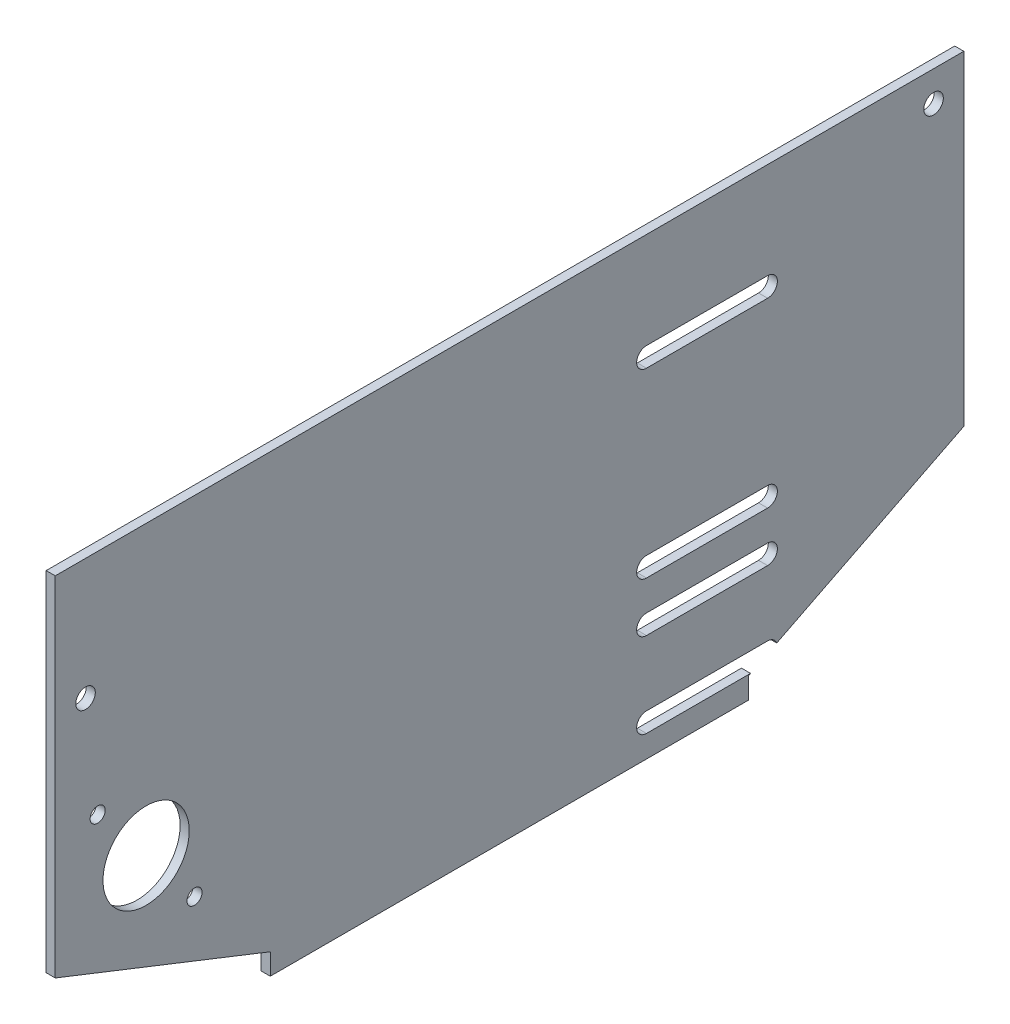
from build123d import *

# Parameters (mm, degrees)
SKETCH1_W           = 300
SKETCH1_H           = 150
SKETCH1_R           = 14.235
BOSS_EXTRUDE1_DEPTH = 3
CUT_EXTRUDE1_REACH  = 337.424
SKETCH2_R           = 3.225
SKETCH3_R           = 2.4892
CUT_EXTRUDE2_DEPTH  = 336.423612765
CUT_EXTRUDE3_DEPTH  = 336.423612765
CUT_EXTRUDE4_DEPTH  = 10


with BuildPart() as part:
    # Sketch1 → Boss-Extrude1 (new body)
    with BuildSketch(Plane(origin=(0, 0, 0), x_dir=(0, 0, -1), z_dir=(1, 0, 0))):
        with Locations((150, 75)):
            Rectangle(SKETCH1_W, SKETCH1_H)
        with Locations((30, 55)):
            Circle(SKETCH1_R, mode=Mode.SUBTRACT)
    extrude(amount=BOSS_EXTRUDE1_DEPTH)

    # Sketch2 → Cut-Extrude1 (cut, up to next)
    with BuildSketch(Plane.ZY, mode=Mode.PRIVATE) as cut_extrude1_sk1:
        with Locations((-290, 140)):
            Circle(SKETCH2_R)
    cut_extrude1_tool1 = extrude(cut_extrude1_sk1.sketch, amount=-CUT_EXTRUDE1_REACH, mode=Mode.PRIVATE) & part.part
    # Sketch2 → Cut-Extrude1 (cut, up to next)
    with BuildSketch(Plane.ZY, mode=Mode.PRIVATE) as cut_extrude1_sk2:
        with Locations((-10, 110)):
            Circle(SKETCH2_R)
    cut_extrude1_tool2 = extrude(cut_extrude1_sk2.sketch, amount=-CUT_EXTRUDE1_REACH, mode=Mode.PRIVATE) & part.part
    # Sketch2 → Cut-Extrude1 (cut, up to next)
    with BuildSketch(Plane.ZY, mode=Mode.PRIVATE) as cut_extrude1_sk3:
        with Locations((-290, 30)):
            Circle(SKETCH2_R)
    cut_extrude1_tool3 = extrude(cut_extrude1_sk3.sketch, amount=-CUT_EXTRUDE1_REACH, mode=Mode.PRIVATE) & part.part
    # Sketch2 → Cut-Extrude1 (cut, up to next)
    with BuildSketch(Plane.ZY, mode=Mode.PRIVATE) as cut_extrude1_sk4:
        with BuildLine():
            Line((-235.201961152, 58.225), (-195.201961152, 58.225))
            ThreePointArc((-195.201961152, 58.225), (-191.976961152, 55), (-195.201961152, 51.775))
            Line((-195.201961152, 51.775), (-235.201961152, 51.775))
            ThreePointArc((-235.201961152, 51.775), (-238.426961152, 55), (-235.201961152, 58.225))
        make_face()
    cut_extrude1_tool4 = extrude(cut_extrude1_sk4.sketch, amount=-CUT_EXTRUDE1_REACH, mode=Mode.PRIVATE) & part.part
    # Sketch2 → Cut-Extrude1 (cut, up to next)
    with BuildSketch(Plane.ZY, mode=Mode.PRIVATE) as cut_extrude1_sk5:
        with BuildLine():
            Line((-195.201961152, 111.77), (-235.201961152, 111.77))
            ThreePointArc((-235.201961152, 111.77), (-238.431961152, 115), (-235.201961152, 118.23))
            Line((-235.201961152, 118.23), (-195.201961152, 118.23))
            ThreePointArc((-195.201961152, 118.23), (-191.971961152, 115), (-195.201961152, 111.77))
        make_face()
    cut_extrude1_tool5 = extrude(cut_extrude1_sk5.sketch, amount=-CUT_EXTRUDE1_REACH, mode=Mode.PRIVATE) & part.part
    # Sketch2 → Cut-Extrude1 (cut, up to next)
    with BuildSketch(Plane.ZY, mode=Mode.PRIVATE) as cut_extrude1_sk6:
        with BuildLine():
            Line((-235.201961152, 41.775), (-195.201961152, 41.775))
            ThreePointArc((-195.201961152, 41.775), (-191.976961152, 38.55), (-195.201961152, 35.325))
            Line((-195.201961152, 35.325), (-235.201961152, 35.325))
            ThreePointArc((-235.201961152, 35.325), (-238.426961152, 38.55), (-235.201961152, 41.775))
        make_face()
    cut_extrude1_tool6 = extrude(cut_extrude1_sk6.sketch, amount=-CUT_EXTRUDE1_REACH, mode=Mode.PRIVATE) & part.part
    # Sketch2 → Cut-Extrude1 (cut, up to next)
    with BuildSketch(Plane.ZY, mode=Mode.PRIVATE) as cut_extrude1_sk7:
        with BuildLine():
            Line((-235.201961152, 13.775), (-195.201961152, 13.775))
            ThreePointArc((-195.201961152, 13.775), (-191.976961152, 10.55), (-195.201961152, 7.325))
            Line((-195.201961152, 7.325), (-235.201961152, 7.325))
            ThreePointArc((-235.201961152, 7.325), (-238.426961152, 10.55), (-235.201961152, 13.775))
        make_face()
    cut_extrude1_tool7 = extrude(cut_extrude1_sk7.sketch, amount=-CUT_EXTRUDE1_REACH, mode=Mode.PRIVATE) & part.part
    add(cut_extrude1_tool1.solids().sort_by_distance((0, 140, -290))[0], mode=Mode.SUBTRACT)
    add(cut_extrude1_tool2.solids().sort_by_distance((0, 110, -10))[0], mode=Mode.SUBTRACT)
    add(cut_extrude1_tool3.solids().sort_by_distance((0, 30, -290))[0], mode=Mode.SUBTRACT)
    add(cut_extrude1_tool4.solids().sort_by_distance((0, 55, -215.201961))[0], mode=Mode.SUBTRACT)
    add(cut_extrude1_tool5.solids().sort_by_distance((0, 115, -215.201961))[0], mode=Mode.SUBTRACT)
    add(cut_extrude1_tool6.solids().sort_by_distance((0, 38.55, -215.201961))[0], mode=Mode.SUBTRACT)
    add(cut_extrude1_tool7.solids().sort_by_distance((0, 10.55, -215.201961))[0], mode=Mode.SUBTRACT)

    # Sketch3 → Cut-Extrude2 (cut, through all)
    with BuildSketch(Plane(origin=(3, 0, 0), x_dir=(0, 0, -1), z_dir=(1, 0, 0))):
        with Locations((14.005743185, 74.73179538)):
            Circle(SKETCH3_R)
        with Locations((45.994256815, 35.26820462)):
            Circle(SKETCH3_R)
    extrude(amount=-CUT_EXTRUDE2_DEPTH, mode=Mode.SUBTRACT)

    # Sketch4 → Cut-Extrude3 (cut, through all)
    with BuildSketch(Plane(origin=(3, 0, 0), x_dir=(0, 0, -1), z_dir=(1, 0, 0))):
        Polygon((71, 7), (0, 35), (0, 0), (71, 0), align=None)
    extrude(amount=-CUT_EXTRUDE3_DEPTH, mode=Mode.SUBTRACT)

    # Sketch5 → Cut-Extrude4 (cut)
    with BuildSketch(Plane(origin=(3, 0, 0), x_dir=(0, 0, -1), z_dir=(1, 0, 0))):
        Polygon((228.92403237, 7), (300, 42.754548564), (300, 0), (228.92403237, 0), align=None)
    extrude(amount=-CUT_EXTRUDE4_DEPTH, mode=Mode.SUBTRACT)


solid = part.part
